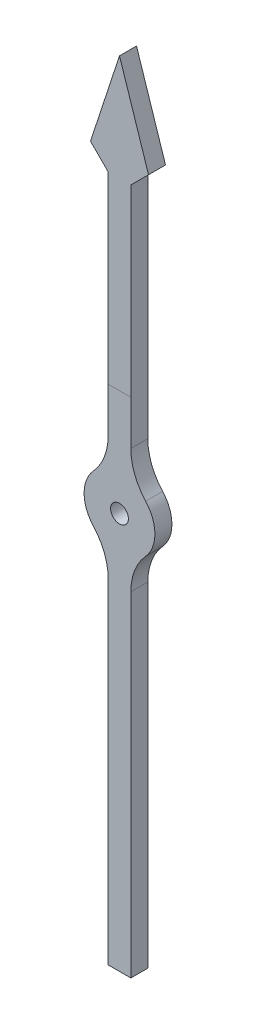
from build123d import *

# Parameters (mm, degrees)
SKETCH1_R           = 0.4
BOSS_EXTRUDE1_DEPTH = 0.762
FILLET1_R           = 2.54


with BuildPart() as part:
    # Sketch1 → Boss-Extrude1 (new body)
    with BuildSketch(Plane.XY):
        with BuildLine():
            Line((-0.508, 13.0175), (-1.30175, 13.81125))
            Line((-1.30175, 13.81125), (0, 17.78))
            Line((0, 17.78), (1.30175, 13.81125))
            Line((1.30175, 13.81125), (0.508, 13.0175))
            Line((0.508, 13.0175), (0.508, 1.504025349))
            ThreePointArc((0.508, 1.504025349), (1.5875, 0), (0.508, -1.504025349))
            Line((0.508, -1.504025349), (0.508, -17.78))
            Line((0.508, -17.78), (-0.508, -17.78))
            Line((-0.508, -17.78), (-0.508, -1.504025349))
            ThreePointArc((-0.508, -1.504025349), (-1.5875, 0), (-0.508, 1.504025349))
            Line((-0.508, 1.504025349), (-0.508, 13.0175))
        make_face()
        Circle(SKETCH1_R, mode=Mode.SUBTRACT)
    extrude(amount=BOSS_EXTRUDE1_DEPTH)

    # Fillet1
    fillet1_edges = [part.edges().sort_by_distance(p)[0] for p in [
        (-0.508, -1.504025349, 0.381),
        (0.508, -1.504025349, 0.381),
        (0.508, 1.504025349, 0.381),
        (-0.508, 1.504025349, 0.381),
    ]]
    fillet(fillet1_edges, radius=FILLET1_R)


solid = part.part
